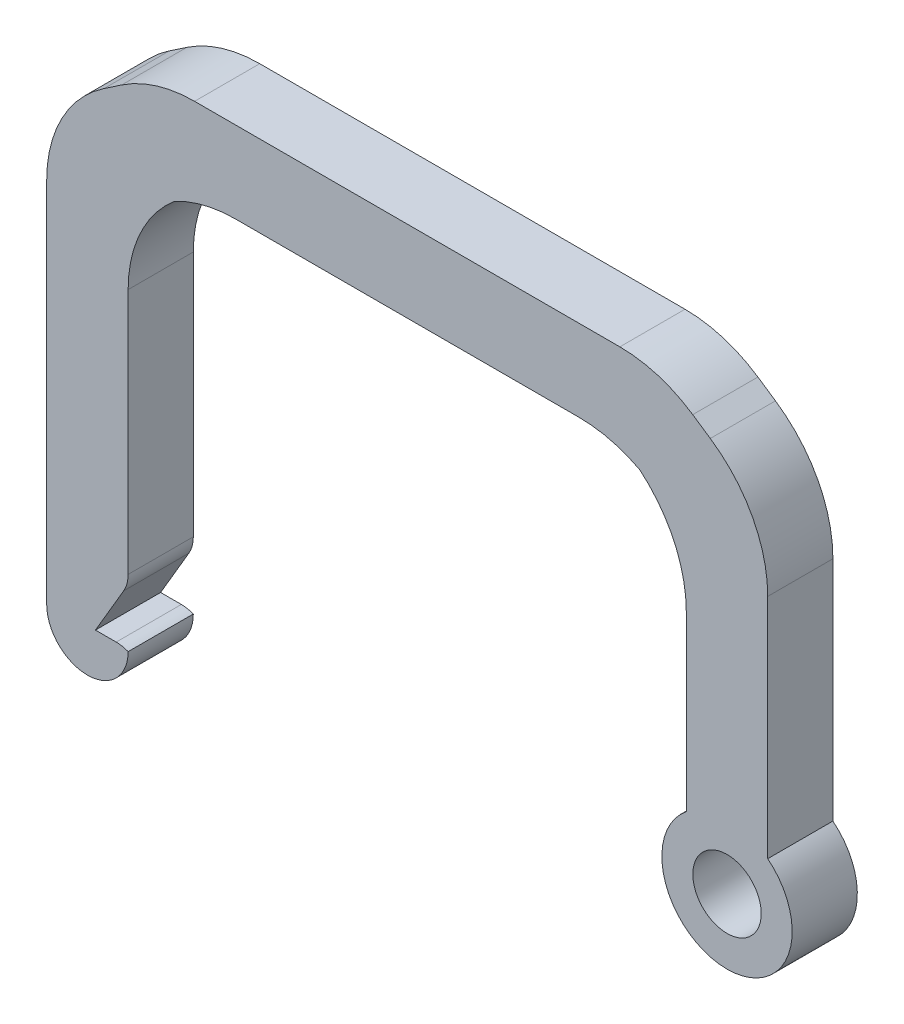
from build123d import *

# Parameters (mm, degrees)
SALIENTE_EXTRUIR4_DEPTH = 4
REDONDEO1_R             = 8
CROQUIS4_R              = 4
SALIENTE_EXTRUIR5_DEPTH = 4
CROQUIS5_R              = 2.1
CORTAR_EXTRUIR1_DEPTH   = 10
CROQUIS6_W              = 5
CROQUIS6_H              = 11
SALIENTE_EXTRUIR6_DEPTH = 4
REDONDEO2_R             = 2.5
CORTAR_EXTRUIR3_DEPTH   = 10
REDONDEO5_R             = 2
REDONDEO6_R             = 2


# Some blends are built 0.0001 mm under size
with BuildPart() as part:
    # Croquis3 → Saliente-Extruir4 (new body)
    with BuildSketch(Plane.XY):
        Polygon((-15.5, 0), (15.5, 0), (22.13230058, -4.473543228), (22.13230058, -22.795964517), (17.13230058, -22.795964517), (17.13230058, -7.795964517), (12.987112718, -5), (-12.987112718, -5), (-17.13230058, -7.795964517), (-17.13230058, -22.795964517), (-22.13230058, -22.795964517), (-22.13230058, -4.473543228), align=None)
    extrude(amount=SALIENTE_EXTRUIR4_DEPTH)

    # Redondeo1
    # the kernel refuses this fillet: 8 mm, written as the material it adds along each edge
    with BuildSketch(Plane(origin=(-12.987112718, -5, 0), x_dir=(1, 0, 0), z_dir=(0, 0, 1)), Plane(origin=(12.987112718, -5, 0), x_dir=(0.8290375725550433, -0.5591929034707446, 0), z_dir=(0, 0, 1))) as redondeo1_piece_1:
        with BuildLine():
            CenterArc((REDONDEO1_R * 0.305730681459, -REDONDEO1_R), REDONDEO1_R, 90, 34)
            Line((-REDONDEO1_R * 0.253462222012, -REDONDEO1_R * 0.170962427445), (0, 0))
            Line((0, 0), (REDONDEO1_R * 0.305730681459, 0))
        make_face()
    extrude(amount=4)
    with BuildSketch(Plane(origin=(-17.13230058, -7.795964517, 0), x_dir=(0.8290375725550426, 0.5591929034707452, 0), z_dir=(0, 0, 1)), Plane(origin=(17.13230058, -7.795964517, 0), x_dir=(0, -1, 0), z_dir=(0, 0, 1))) as redondeo1_piece_2:
        with BuildLine():
            CenterArc((REDONDEO1_R * 0.531709431661, -REDONDEO1_R), REDONDEO1_R, 90, 56)
            Line((-REDONDEO1_R * 0.297328140894, -REDONDEO1_R * 0.440807096529), (0, 0))
            Line((0, 0), (REDONDEO1_R * 0.531709431661, 0))
        make_face()
    extrude(amount=4)
    # the kernel refuses this fillet: 8 mm, written as the material it takes off along each edge
    with BuildSketch(Plane(origin=(22.13230058, -4.473543228, -10.634188633), x_dir=(-0.8290375725550431, 0.5591929034707448, 0), z_dir=(0, 0, 1))) as redondeo1_2_piece_1:
        with BuildLine():
            CenterArc((REDONDEO1_R * 0.531709431661, REDONDEO1_R), REDONDEO1_R, 214, 56)
            Line((-REDONDEO1_R * 0.297328140894, REDONDEO1_R * 0.440807096529), (0, 0))
            Line((0, 0), (REDONDEO1_R * 0.531709431661, 0))
        make_face()
    extrude(amount=25.268377266, mode=Mode.SUBTRACT)
    with BuildSketch(Plane(origin=(15.5, 0, -6.114613629), x_dir=(-1, 0, 0), z_dir=(0, 0, 1))) as redondeo1_2_piece_2:
        with BuildLine():
            CenterArc((REDONDEO1_R * 0.305730681459, REDONDEO1_R), REDONDEO1_R, 236, 34)
            Line((-REDONDEO1_R * 0.253462222012, REDONDEO1_R * 0.170962427445), (0, 0))
            Line((0, 0), (REDONDEO1_R * 0.305730681459, 0))
        make_face()
    extrude(amount=16.229227258, mode=Mode.SUBTRACT)
    with BuildSketch(Plane(origin=(-15.5, 0, -6.114613629), x_dir=(1, 0, 0), z_dir=(0, 0, 1))) as redondeo1_2_piece_3:
        with BuildLine():
            CenterArc((REDONDEO1_R * 0.305730681459, -REDONDEO1_R), REDONDEO1_R, 90, 34)
            Line((-REDONDEO1_R * 0.253462222012, -REDONDEO1_R * 0.170962427445), (0, 0))
            Line((0, 0), (REDONDEO1_R * 0.305730681459, 0))
        make_face()
    extrude(amount=16.229227258, mode=Mode.SUBTRACT)
    with BuildSketch(Plane(origin=(-22.13230058, -4.473543228, -10.634188633), x_dir=(0.8290375725550428, 0.5591929034707449, 0), z_dir=(0, 0, 1))) as redondeo1_2_piece_4:
        with BuildLine():
            CenterArc((REDONDEO1_R * 0.531709431661, -REDONDEO1_R), REDONDEO1_R, 90, 56)
            Line((-REDONDEO1_R * 0.297328140894, -REDONDEO1_R * 0.440807096529), (0, 0))
            Line((0, 0), (REDONDEO1_R * 0.531709431661, 0))
        make_face()
    extrude(amount=25.268377266, mode=Mode.SUBTRACT)

    # Croquis4 → Saliente-Extruir5 (add, through all)
    with BuildSketch(Plane.XY.offset(4)):
        with Locations((19.63230058, -25.795964517)):
            Circle(CROQUIS4_R)
    extrude(amount=-SALIENTE_EXTRUIR5_DEPTH)

    # Croquis5 → Cortar-Extruir1 (cut)
    with BuildSketch(Plane.XY.offset(4)):
        with Locations((19.63230058, -25.795964517)):
            Circle(CROQUIS5_R)
    extrude(amount=-CORTAR_EXTRUIR1_DEPTH, mode=Mode.SUBTRACT)

    # Croquis6 → Saliente-Extruir6 (add, through all)
    with BuildSketch(Plane.XY.offset(4)):
        with Locations((-19.63230058, -28.295964517)):
            Rectangle(CROQUIS6_W, CROQUIS6_H)
    extrude(amount=-SALIENTE_EXTRUIR6_DEPTH)

    # Redondeo2
    redondeo2_edges = [part.edges().sort_by_distance(p)[0] for p in [
        (-17.13230058, -33.795964517, 2),
        (-22.13230058, -33.795964517, 2),
    ]]
    fillet(redondeo2_edges, radius=REDONDEO2_R - 0.0001)  # a hair under: the kernel refuses the full size

    # Croquis8 → Cortar-Extruir3 (cut)
    with BuildSketch(Plane.XY.offset(4)):
        Polygon((-17.13230058, -31.156317686), (-19.139649056, -31.156317686), (-17.13230058, -27.735081186), align=None)
    extrude(amount=-CORTAR_EXTRUIR3_DEPTH, mode=Mode.SUBTRACT)

    # Redondeo5
    redondeo5_edges = [part.edges().sort_by_distance(p)[0] for p in [
        (-17.13230058, -27.735081186, 2),
    ]]
    fillet(redondeo5_edges, radius=REDONDEO5_R)

    # Redondeo6
    # the kernel refuses this fillet: 2 mm, written as the material it takes off along each edge
    with BuildSketch(Plane(origin=(-17.13230058, -31.156317686, 5.83619537), x_dir=(-1, 0, 0), z_dir=(0, 0, -1))) as redondeo6_piece_1:
        with BuildLine():
            CenterArc((0.734478148, -2), REDONDEO6_R, 90, 21.545444272)
            Line((0, -0.139746832), (-0.014689563, -0.102541768))
            ThreePointArc((-0.014689563, -0.102541768), (-0.04, -0.069873416), (-0.04, 0))
            Line((-0.04, 0), (0, 0.04))
            Line((0, 0.04), (0.734478148, 0.04))
            Line((0.734478148, 0.04), (0.734478148, 0))
        make_face()
    extrude(amount=7.672390741, mode=Mode.SUBTRACT)


solid = part.part
